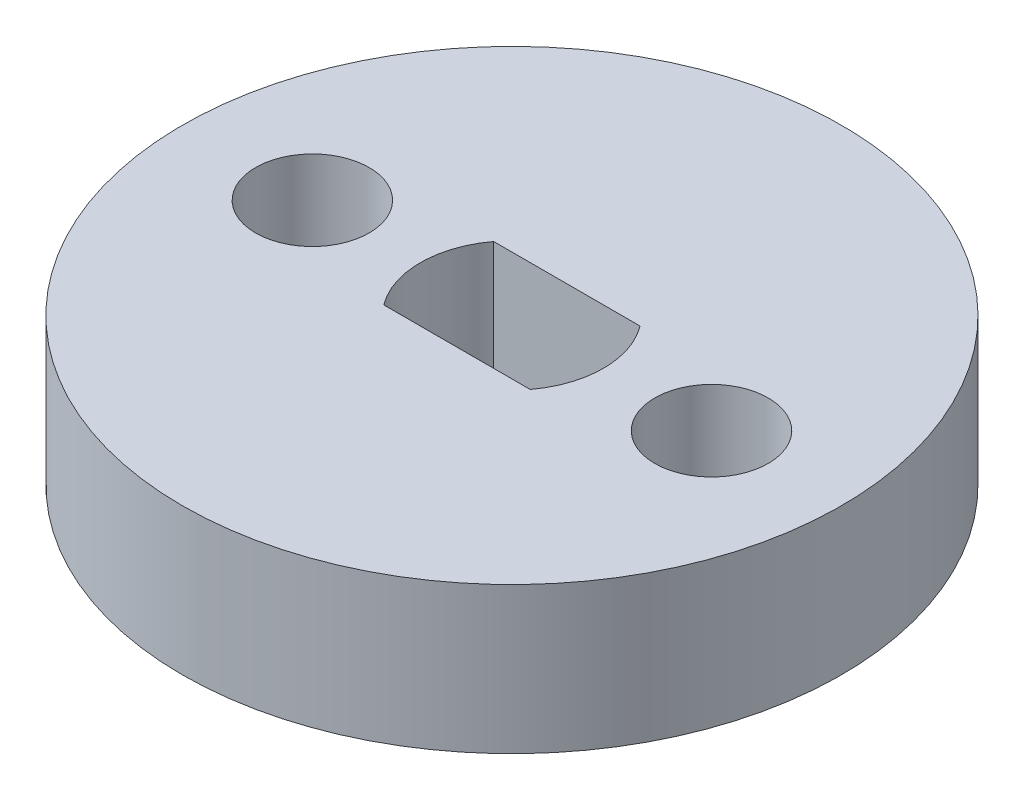
from build123d import *

# Parameters (mm, degrees)
SKETCH1_R          = 9
BASE_FLANGE1_DEPTH = 4
CUT_EXTRUDE1_DEPTH = 10
SKETCH7_R          = 1.55
CUT_EXTRUDE2_DEPTH = 10


# Sheet-metal steps are written as plain solids
with BuildPart() as part:
    # Sketch1 → Base-Flange1 (new body)
    with BuildSketch(Plane(origin=(0, 0, 0), x_dir=(1, 0, 0), z_dir=(0, 1, 0))):
        with Locations(Location((0, 0, 0), (0, 0, 270))):
            Circle(SKETCH1_R)
    extrude(amount=-BASE_FLANGE1_DEPTH)

    # Sketch6 → Cut-Extrude1 (cut)
    with BuildSketch(Plane(origin=(0, 0, 0), x_dir=(1, 0, 0), z_dir=(0, 1, 0))):
        with BuildLine():
            Line((-2, 1.5), (2, 1.5))
            ThreePointArc((2, 1.5), (2.5, 0), (2, -1.5))
            Line((2, -1.5), (0, -1.5))
            Line((0, -1.5), (-2, -1.5))
            ThreePointArc((-2, -1.5), (-2.5, 0), (-2, 1.5))
        make_face()
    extrude(amount=-CUT_EXTRUDE1_DEPTH, mode=Mode.SUBTRACT)

    # Sketch7 → Cut-Extrude2 (cut)
    with BuildSketch(Plane(origin=(0, 0, 0), x_dir=(1, 0, 0), z_dir=(0, 1, 0))):
        with Locations(Location((-5.45, 0, 0), (0, 0, 270))):
            Circle(SKETCH7_R)
        with Locations(Location((5.45, 0, 0), (0, 0, 270))):
            Circle(SKETCH7_R)
    extrude(amount=-CUT_EXTRUDE2_DEPTH, mode=Mode.SUBTRACT)


solid = part.part
